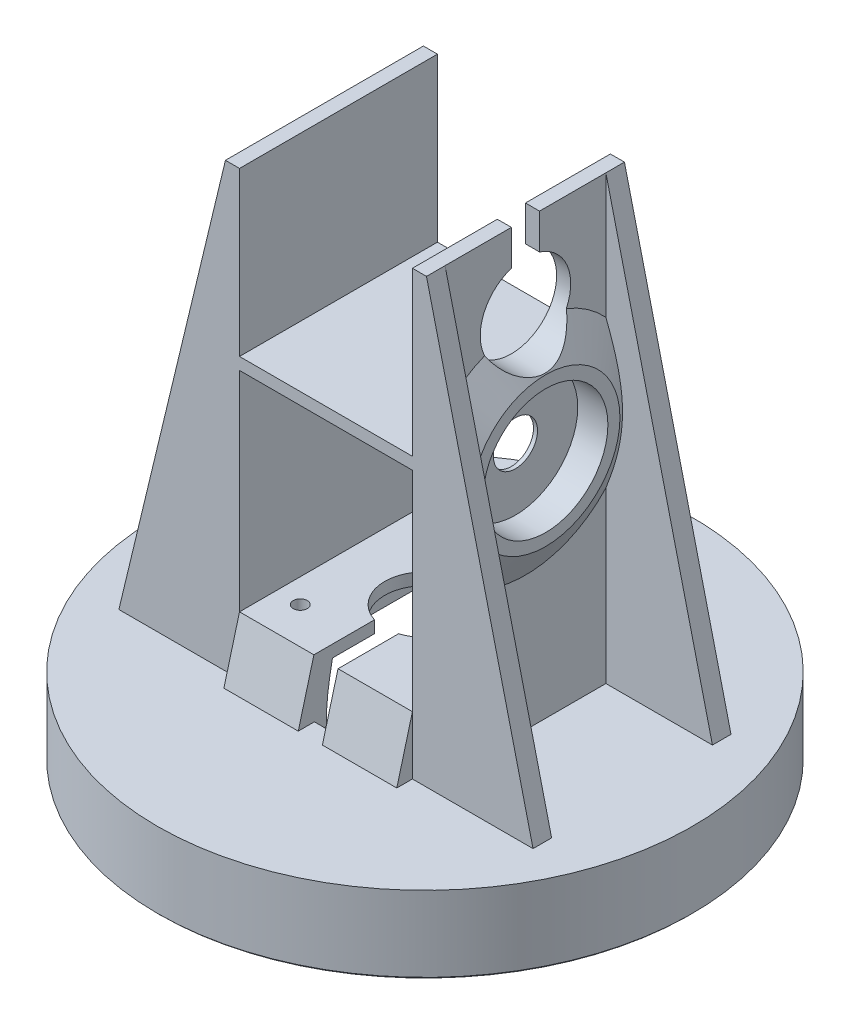
from build123d import *

# Parameters (mm, degrees)
SKETCH1_R            = 66.525
SKETCH1_R_2          = 63.525
BOSS_EXTRUDE1_DEPTH  = 16.75
SKETCH2_R            = 66.525
BOSS_EXTRUDE2_DEPTH  = 2.5
CHAMFER1_SIZE        = 0.5
SKETCH3_R            = 3
BOSS_EXTRUDE3_DEPTH  = 4
CHAMFER2_SIZE        = 0.5
CUT_EXTRUDE1_REACH   = 98.03
SKETCH4_W            = 43
SKETCH4_H            = 43
SKETCH5_W            = 43
SKETCH5_H            = 3
BOSS_EXTRUDE4_DEPTH  = 14.5
SKETCH6_W            = 43
SKETCH6_H            = 49
BOSS_EXTRUDE5_DEPTH  = 3
CUT_EXTRUDE2_REACH   = 101.951
SKETCH7_R            = 1.75
CHAMFER3_SIZE        = 4
CHAMFER3_SIZE_2      = 14.92820323
CHAMFER5_SIZE        = 1.5
CHAMFER5_SIZE2       = 8.506922729
FILLET1_R            = 50
BOSS_EXTRUDE6_DEPTH  = 4.614737
SKETCH10_W           = 3.5
SKETCH10_H           = 40
BOSS_EXTRUDE7_DEPTH  = 110
CUT_EXTRUDE3_REACH   = 171.94
SKETCH11_R           = 5.5
SKETCH12_R           = 15.5
CUT_EXTRUDE4_DEPTH   = 2.5
BOSS_EXTRUDE8_START  = 5
SKETCH13_R           = 18.5
SKETCH13_R_2         = 15.5
BOSS_EXTRUDE8_DEPTH  = 5
MIRROR4_COPY_1_DEPTH = 4.614737
CHAMFER7_SIZE        = 8.660254038
CHAMFER7_SIZE_2      = 5
SKETCH14_W           = 43
SKETCH14_H           = 3
BOSS_EXTRUDE9_DEPTH  = 49.229473419
CUT_EXTRUDE5_REACH   = 171.94


with BuildPart() as part:
    # Sketch1 → Boss-Extrude1 (new body)
    with BuildSketch(Plane(origin=(0, 0, 0), x_dir=(1, 0, 0), z_dir=(0, 1, 0))):
        with Locations(Location((0, 0, 0), (0, 0, 270))):
            Circle(SKETCH1_R)
        with Locations(Location((0, 0, 0), (0, 0, 270))):
            Circle(SKETCH1_R_2, mode=Mode.SUBTRACT)
    extrude(amount=BOSS_EXTRUDE1_DEPTH)

    # Sketch2 → Boss-Extrude2 (add)
    with BuildSketch(Plane(origin=(0, 16.75, 0), x_dir=(1, 0, 0), z_dir=(0, 1, 0))):
        with Locations(Location((0, 0, 0), (0, 0, 270))):
            Circle(SKETCH2_R)
    extrude(amount=BOSS_EXTRUDE2_DEPTH)

    # Chamfer1
    chamfer1_edges = [part.edges().sort_by_distance(p)[0] for p in [
        (0, 0, -66.525),
        (0, 0, -63.525),
    ]]
    chamfer(chamfer1_edges, length=CHAMFER1_SIZE)

    # Sketch3 → Boss-Extrude3 (add)
    with BuildSketch(Plane.XZ.offset(-16.75)):
        with Locations(Location((0, 37.5, 0), (0, 0, 90))):
            Circle(SKETCH3_R)
        with Locations(Location((37.5, 0, 0), (0, 0, 90))):
            Circle(SKETCH3_R)
        with Locations(Location((0, -37.5, 0), (0, 0, 90))):
            Circle(SKETCH3_R)
        with Locations(Location((-37.5, 0, 0), (0, 0, 90))):
            Circle(SKETCH3_R)
    extrude(amount=BOSS_EXTRUDE3_DEPTH)

    # Chamfer2
    chamfer2_edges = [part.edges().sort_by_distance(p)[0] for p in [
        (0, 16.75, 34.5),
        (37.5, 16.75, -3),
        (0, 16.75, -40.5),
        (-37.5, 16.75, -3),
    ]]
    chamfer(chamfer2_edges, length=CHAMFER2_SIZE)

    # Sketch4 → Cut-Extrude1 (cut, up to next)
    with BuildSketch(Plane(origin=(0, 19.25, 0), x_dir=(1, 0, 0), z_dir=(0, 1, 0)), mode=Mode.PRIVATE) as cut_extrude1_sk1:
        Rectangle(SKETCH4_W, SKETCH4_H)
    cut_extrude1_tool1 = extrude(cut_extrude1_sk1.sketch, amount=-CUT_EXTRUDE1_REACH, mode=Mode.PRIVATE) & part.part
    add(cut_extrude1_tool1.solids().sort_by_distance((0, 19.25, 0))[0], mode=Mode.SUBTRACT)

    # Sketch5 → Boss-Extrude4 (add)
    with BuildSketch(Plane(origin=(0, 19.25, 0), x_dir=(1, 0, 0), z_dir=(0, 1, 0))):
        with Locations((0, 23)):
            Rectangle(SKETCH5_W, SKETCH5_H)
        with Locations((0, -23)):
            Rectangle(SKETCH5_W, SKETCH5_H)
    extrude(amount=BOSS_EXTRUDE4_DEPTH)

    # Sketch6 → Boss-Extrude5 (add)
    with BuildSketch(Plane(origin=(0, 33.75, 0), x_dir=(1, 0, 0), z_dir=(0, 1, 0))):
        Rectangle(SKETCH6_W, SKETCH6_H)
    extrude(amount=-BOSS_EXTRUDE5_DEPTH)

    # Sketch7 → Cut-Extrude2 (cut, up to next)
    with BuildSketch(Plane(origin=(0, 33.75, 0), x_dir=(1, 0, 0), z_dir=(0, 1, 0)), mode=Mode.PRIVATE) as cut_extrude2_sk1:
        with Locations(Location((15.5, 15.5, 0), (0, 0, 270))):
            Circle(SKETCH7_R)
    cut_extrude2_tool1 = extrude(cut_extrude2_sk1.sketch, amount=-CUT_EXTRUDE2_REACH, mode=Mode.PRIVATE) & part.part
    # Sketch7 → Cut-Extrude2 (cut, up to next)
    with BuildSketch(Plane(origin=(0, 33.75, 0), x_dir=(1, 0, 0), z_dir=(0, 1, 0)), mode=Mode.PRIVATE) as cut_extrude2_sk2:
        with Locations(Location((-15.5, 15.5, 0), (0, 0, 270))):
            Circle(SKETCH7_R)
    cut_extrude2_tool2 = extrude(cut_extrude2_sk2.sketch, amount=-CUT_EXTRUDE2_REACH, mode=Mode.PRIVATE) & part.part
    # Sketch7 → Cut-Extrude2 (cut, up to next)
    with BuildSketch(Plane(origin=(0, 33.75, 0), x_dir=(1, 0, 0), z_dir=(0, 1, 0)), mode=Mode.PRIVATE) as cut_extrude2_sk3:
        with Locations(Location((-15.5, -15.5, 0), (0, 0, 270))):
            Circle(SKETCH7_R)
    cut_extrude2_tool3 = extrude(cut_extrude2_sk3.sketch, amount=-CUT_EXTRUDE2_REACH, mode=Mode.PRIVATE) & part.part
    # Sketch7 → Cut-Extrude2 (cut, up to next)
    with BuildSketch(Plane(origin=(0, 33.75, 0), x_dir=(1, 0, 0), z_dir=(0, 1, 0)), mode=Mode.PRIVATE) as cut_extrude2_sk4:
        with Locations(Location((15.5, -15.5, 0), (0, 0, 270))):
            Circle(SKETCH7_R)
    cut_extrude2_tool4 = extrude(cut_extrude2_sk4.sketch, amount=-CUT_EXTRUDE2_REACH, mode=Mode.PRIVATE) & part.part
    # Sketch7 → Cut-Extrude2 (cut, up to next)
    with BuildSketch(Plane(origin=(0, 33.75, 0), x_dir=(1, 0, 0), z_dir=(0, 1, 0)), mode=Mode.PRIVATE) as cut_extrude2_sk5:
        with BuildLine():
            Line((-3, -24.5), (-3, -9.539392014))
            ThreePointArc((-3, -9.539392014), (0, 10), (3, -9.539392014))
            Line((3, -9.539392014), (3, -24.5))
            Line((3, -24.5), (-3, -24.5))
        make_face()
    cut_extrude2_tool5 = extrude(cut_extrude2_sk5.sketch, amount=-CUT_EXTRUDE2_REACH, mode=Mode.PRIVATE) & part.part
    add(cut_extrude2_tool1.solids().sort_by_distance((15.5, 33.75, -15.5))[0], mode=Mode.SUBTRACT)
    add(cut_extrude2_tool2.solids().sort_by_distance((-15.5, 33.75, -15.5))[0], mode=Mode.SUBTRACT)
    add(cut_extrude2_tool3.solids().sort_by_distance((-15.5, 33.75, 15.5))[0], mode=Mode.SUBTRACT)
    add(cut_extrude2_tool4.solids().sort_by_distance((15.5, 33.75, 15.5))[0], mode=Mode.SUBTRACT)
    add(cut_extrude2_tool5.solids().sort_by_distance((0, 33.75, 3.754926))[0], mode=Mode.SUBTRACT)

    # Chamfer3
    # the kernel refuses this chamfer: 14.92820323, 4 mm, written as the material it adds along each edge
    with BuildSketch(Plane(origin=(-35.764387332, 19.25, 24.5), x_dir=(0, -0.13751244702129095, 0.9905000388259542), z_dir=(1, 0, 0))) as chamfer3_piece_1_section:
        Polygon((CHAMFER3_SIZE * 0.990500038826, -CHAMFER3_SIZE * 0.137512447021), (-CHAMFER3_SIZE_2 * 0.137512447024, -CHAMFER3_SIZE_2 * 0.990500038844), (0, 0), align=None)
    chamfer3_piece_1 = extrude(amount=96.028774665, mode=Mode.PRIVATE)
    chamfer3_piece_1 = split(chamfer3_piece_1, bisect_by=Plane(origin=(-3, 24.218107634, 25.834399786), z_dir=(-1, 0, 0)), keep=Keep.TOP, mode=Mode.PRIVATE)
    chamfer3_piece_1 = split(chamfer3_piece_1, bisect_by=Plane(origin=(-21.5, 24.218107634, 25.834399786), z_dir=(1, 0, 0)), keep=Keep.TOP, mode=Mode.PRIVATE)
    chamfer3_piece_1 = split(chamfer3_piece_1, bisect_by=Plane(origin=(-12.25, 33.75, 25.834399786), z_dir=(0, -1, 0)), keep=Keep.TOP, mode=Mode.PRIVATE)
    add(chamfer3_piece_1)
    with BuildSketch(Plane(origin=(3, 19.25, 24.5), x_dir=(0, -0.13751244702129095, 0.9905000388259542), z_dir=(1, 0, 0))) as chamfer3_piece_2_section:
        Polygon((CHAMFER3_SIZE * 0.990500038826, -CHAMFER3_SIZE * 0.137512447021), (-CHAMFER3_SIZE_2 * 0.137512447024, -CHAMFER3_SIZE_2 * 0.990500038844), (0, 0), align=None)
    chamfer3_piece_2 = extrude(amount=18.5, mode=Mode.PRIVATE)
    chamfer3_piece_2 = split(chamfer3_piece_2, bisect_by=Plane(origin=(12.25, 33.75, 25.834399786), z_dir=(0, -1, 0)), keep=Keep.TOP, mode=Mode.PRIVATE)
    add(chamfer3_piece_2)
    with BuildSketch(Plane(origin=(-21.5, 19.25, 24.5), x_dir=(0, -0.13751244702129095, 0.9905000388259542), z_dir=(1, 0, 0))) as chamfer3_piece_3_section:
        Polygon((CHAMFER3_SIZE * 0.990500038826, -CHAMFER3_SIZE * 0.137512447021), (-CHAMFER3_SIZE_2 * 0.137512447024, -CHAMFER3_SIZE_2 * 0.990500038844), (0, 0), align=None)
    chamfer3_piece_3 = extrude(amount=18.5, mode=Mode.PRIVATE)
    chamfer3_piece_3 = split(chamfer3_piece_3, bisect_by=Plane(origin=(-12.25, 33.75, 25.834399786), z_dir=(0, -1, 0)), keep=Keep.TOP, mode=Mode.PRIVATE)
    add(chamfer3_piece_3)
    with BuildSketch(Plane(origin=(-60.264387332, 19.25, 24.5), x_dir=(0, -0.13751244702129095, 0.9905000388259542), z_dir=(1, 0, 0))) as chamfer3_piece_4_section:
        Polygon((CHAMFER3_SIZE * 0.990500038826, -CHAMFER3_SIZE * 0.137512447021), (-CHAMFER3_SIZE_2 * 0.137512447024, -CHAMFER3_SIZE_2 * 0.990500038844), (0, 0), align=None)
    chamfer3_piece_4 = extrude(amount=96.028774665, mode=Mode.PRIVATE)
    chamfer3_piece_4 = split(chamfer3_piece_4, bisect_by=Plane(origin=(3, 24.218107634, 25.834399786), z_dir=(1, 0, 0)), keep=Keep.TOP, mode=Mode.PRIVATE)
    chamfer3_piece_4 = split(chamfer3_piece_4, bisect_by=Plane(origin=(21.5, 24.218107634, 25.834399786), z_dir=(-1, 0, 0)), keep=Keep.TOP, mode=Mode.PRIVATE)
    chamfer3_piece_4 = split(chamfer3_piece_4, bisect_by=Plane(origin=(12.25, 33.75, 25.834399786), z_dir=(0, -1, 0)), keep=Keep.TOP, mode=Mode.PRIVATE)
    add(chamfer3_piece_4)
    with BuildSketch(Plane(origin=(21.5, 19.25, -24.5), x_dir=(0, -0.13751244702129095, -0.9905000388259542), z_dir=(-1, 0, 0))) as chamfer3_piece_5_section:
        Polygon((CHAMFER3_SIZE * 0.990500038826, -CHAMFER3_SIZE * 0.137512447021), (-CHAMFER3_SIZE_2 * 0.137512447024, -CHAMFER3_SIZE_2 * 0.990500038844), (0, 0), align=None)
    chamfer3_piece_5 = extrude(amount=43, mode=Mode.PRIVATE)
    chamfer3_piece_5 = split(chamfer3_piece_5, bisect_by=Plane(origin=(0, 33.75, -25.834399786), z_dir=(0, -1, 0)), keep=Keep.TOP, mode=Mode.PRIVATE)
    add(chamfer3_piece_5)

    # Chamfer5
    chamfer5_edges = [part.edges().sort_by_distance(p)[0] for p in [
        (0, 30.75, -21.5),
        (12.25, 30.75, 21.5),
        (-12.25, 30.75, 21.5),
    ]]
    chamfer5_side = [part.faces().sort_by_distance(p)[0] for p in [
        (0, 30.75, -20.891888168),
    ]]
    chamfer(chamfer5_edges, length=CHAMFER5_SIZE, length2=CHAMFER5_SIZE2, reference=chamfer5_side[0])

    # Fillet1
    # the kernel refuses this fillet: 50 mm, written as the material it adds along each edge
    with BuildSketch(Plane(origin=(-21.5, 22.243077271, -21.5), x_dir=(0, 0.9848077530122084, 0.17364817766692914), z_dir=(1, 0, 0))) as fillet1_piece_1:
        with BuildLine():
            CenterArc((FILLET1_R * 0.0874886635259, FILLET1_R), FILLET1_R, 260, 10)
            Line((-FILLET1_R * 0.086159514141, FILLET1_R * 0.0151922469878), (0, 0))
            Line((0, 0), (FILLET1_R * 0.0874886635259, 0))
        make_face()
    extrude(amount=43)
    with BuildSketch(Plane(origin=(21.5, 22.243077271, 21.5), x_dir=(0, 0.9848077530122081, -0.17364817766692925), z_dir=(-1, 0, 0)), Plane(origin=(-3, 22.243077271, 21.5), x_dir=(0, 0.9848077530122081, -0.17364817766692925), z_dir=(-1, 0, 0))) as fillet1_piece_2:
        with BuildLine():
            CenterArc((FILLET1_R * 0.0874886635259, FILLET1_R), FILLET1_R, 260, 10)
            Line((-FILLET1_R * 0.086159514141, FILLET1_R * 0.0151922469878), (0, 0))
            Line((0, 0), (FILLET1_R * 0.0874886635259, 0))
        make_face()
    extrude(amount=18.5)
    with BuildSketch(Plane(origin=(21.5, 22.243077271, 21.5), x_dir=(0, 0.9848077530122081, -0.17364817766692925), z_dir=(-1, 0, 0))) as fillet1_piece_3_section:
        with BuildLine():
            CenterArc((FILLET1_R * 0.0874886635259, FILLET1_R), FILLET1_R, 260, 10)
            Line((-FILLET1_R * 0.086159514141, FILLET1_R * 0.0151922469878), (0, 0))
            Line((0, 0), (FILLET1_R * 0.0874886635259, 0))
        make_face()
    fillet1_piece_3 = extrude(amount=29.436082941, mode=Mode.PRIVATE)
    fillet1_piece_3 = split(fillet1_piece_3, bisect_by=Plane(origin=(-3, 22.267794389, 21.78251796), z_dir=(-1, 0, 0)), keep=Keep.TOP, mode=Mode.PRIVATE)
    add(fillet1_piece_3)
    with BuildSketch(Plane(origin=(7.936082941, 22.243077271, 21.5), x_dir=(0, 0.9848077530122081, -0.17364817766692925), z_dir=(-1, 0, 0))) as fillet1_piece_4_section:
        with BuildLine():
            CenterArc((FILLET1_R * 0.0874886635259, FILLET1_R), FILLET1_R, 260, 10)
            Line((-FILLET1_R * 0.086159514141, FILLET1_R * 0.0151922469878), (0, 0))
            Line((0, 0), (FILLET1_R * 0.0874886635259, 0))
        make_face()
    fillet1_piece_4 = extrude(amount=29.436082941, mode=Mode.PRIVATE)
    fillet1_piece_4 = split(fillet1_piece_4, bisect_by=Plane(origin=(3, 22.267794389, 21.78251796), z_dir=(1, 0, 0)), keep=Keep.TOP, mode=Mode.PRIVATE)
    add(fillet1_piece_4)

    # Sketch9 → Boss-Extrude6 (add)
    with BuildSketch(Plane.XY.offset(-20)):
        Polygon((21.5, 19.25), (21.5, 129.25), (25, 129.25), (51.5, 19.25), align=None)
    boss_extrude6 = extrude(amount=-BOSS_EXTRUDE6_DEPTH)

    # Mirror3: Boss-Extrude6 across plane
    add(boss_extrude6.mirror(Plane.XY))

    # Sketch10 → Boss-Extrude7 (add)
    with BuildSketch(Plane(origin=(0, 19.25, 0), x_dir=(1, 0, 0), z_dir=(0, 1, 0))):
        with Locations((23.25, 0)):
            Rectangle(SKETCH10_W, SKETCH10_H)
    boss_extrude7 = extrude(amount=BOSS_EXTRUDE7_DEPTH)

    # Sketch11 → Cut-Extrude3 (cut, up to next)
    with BuildSketch(Plane.ZY.offset(-21.5), mode=Mode.PRIVATE) as cut_extrude3_sk1:
        with Locations((0, 79.75)):
            Circle(SKETCH11_R)
    cut_extrude3_tool1 = extrude(cut_extrude3_sk1.sketch, amount=-CUT_EXTRUDE3_REACH, mode=Mode.PRIVATE) & part.part
    cut_extrude3 = cut_extrude3_tool1.solids().sort_by_distance((21.5, 79.75, 0))[0]
    add(cut_extrude3, mode=Mode.SUBTRACT)

    # Sketch12 → Cut-Extrude4 (cut)
    with BuildSketch(Plane(origin=(25, 0, 0), x_dir=(0, 0, -1), z_dir=(1, 0, 0))):
        with Locations((0, 79.75)):
            Circle(SKETCH12_R)
    cut_extrude4 = extrude(amount=-CUT_EXTRUDE4_DEPTH, mode=Mode.SUBTRACT)

    # Sketch13 → Boss-Extrude8 (add)
    with BuildSketch(Plane(origin=(25, 0, 0), x_dir=(0, 0, -1), z_dir=(1, 0, 0)).offset(BOSS_EXTRUDE8_START)):
        with Locations(Location((0, 79.75, 0), (0, 0, 180))):
            Circle(SKETCH13_R)
        with Locations((0, 79.75)):
            Circle(SKETCH13_R_2, mode=Mode.SUBTRACT)
    boss_extrude8 = extrude(amount=-BOSS_EXTRUDE8_DEPTH)

    # Mirror4: Boss-Extrude6, Boss-Extrude7, Cut-Extrude3, Cut-Extrude4, Boss-Extrude8 across plane
    add(boss_extrude6.mirror(Plane(origin=(0, 0, 0), x_dir=(0, 0, 1), z_dir=(1, 0, 0))))
    add(boss_extrude7.mirror(Plane(origin=(0, 0, 0), x_dir=(0, 0, 1), z_dir=(1, 0, 0))))
    add(cut_extrude3.mirror(Plane(origin=(0, 0, 0), x_dir=(0, 0, 1), z_dir=(1, 0, 0))), mode=Mode.SUBTRACT)
    add(cut_extrude4.mirror(Plane(origin=(0, 0, 0), x_dir=(0, 0, 1), z_dir=(1, 0, 0))), mode=Mode.SUBTRACT)
    add(boss_extrude8.mirror(Plane(origin=(0, 0, 0), x_dir=(0, 0, 1), z_dir=(1, 0, 0))))

    # Mirror4 copy 1 sketch → Mirror4 copy 1 (add)
    with BuildSketch(Plane(origin=(0, 0, 20), x_dir=(-1, 0, 0), z_dir=(0, 0, -1))):
        Polygon((21.5, 19.25), (21.5, 129.25), (25, 129.25), (51.5, 19.25), align=None)
    extrude(amount=-MIRROR4_COPY_1_DEPTH)

    # Chamfer7
    # the kernel refuses this chamfer: 8.660254038, 5 mm, written as the material it adds along each edge
    with BuildSketch(Plane(origin=(25, 79.75, 0), x_dir=(0, 0, 1), z_dir=(0, 1, 0))) as chamfer7_piece_1_section:
        Polygon((18.5 + CHAMFER7_SIZE, 0), (18.5, CHAMFER7_SIZE_2), (18.5, 0), align=None)
    chamfer7_piece_1 = revolve(axis=Axis((25, 79.75, 0), (1, 0, 0)), mode=Mode.PRIVATE)
    chamfer7_piece_1 = split(chamfer7_piece_1, bisect_by=Plane(origin=(25.718533096, 57.535930148, -20), z_dir=(0, 0, 1)), keep=Keep.TOP, mode=Mode.PRIVATE)
    chamfer7_piece_1 = split(chamfer7_piece_1, bisect_by=Plane(origin=(25.718533096, 57.535930148, 24.614737), z_dir=(0, 0, -1)), keep=Keep.TOP, mode=Mode.PRIVATE)
    add(chamfer7_piece_1)
    with BuildSketch(Plane(origin=(-25, 79.75, 0), x_dir=(0, 0, 1), z_dir=(0, 1, 0))) as chamfer7_piece_2_section:
        Polygon((18.5 + CHAMFER7_SIZE, 0), (18.5, -CHAMFER7_SIZE_2), (18.5, 0), align=None)
    chamfer7_piece_2 = revolve(axis=Axis((-25, 79.75, 0), (1, 0, 0)), mode=Mode.PRIVATE)
    chamfer7_piece_2 = split(chamfer7_piece_2, bisect_by=Plane(origin=(-25.718533096, 57.535930148, 20), z_dir=(0, 0, -1)), keep=Keep.TOP, mode=Mode.PRIVATE)
    chamfer7_piece_2 = split(chamfer7_piece_2, bisect_by=Plane(origin=(-25.718533096, 57.535930148, -24.614737), z_dir=(0, 0, 1)), keep=Keep.TOP, mode=Mode.PRIVATE)
    add(chamfer7_piece_2)

    # Sketch14 → Boss-Extrude9 (add)
    with BuildSketch(Plane.XY.offset(24.61473671)):
        with Locations((0, 87.25)):
            Rectangle(SKETCH14_W, SKETCH14_H)
    extrude(amount=-BOSS_EXTRUDE9_DEPTH)

    # Sketch15 → Cut-Extrude5 (cut, up to next)
    with BuildSketch(Plane.ZY.offset(-21.5), mode=Mode.PRIVATE) as cut_extrude5_sk1:
        with BuildLine():
            Line((-3.5, 129.25), (-3.5, 120.44170239))
            ThreePointArc((-3.5, 120.44170239), (0, 98.5), (3.5, 120.44170239))
            Line((3.5, 120.44170239), (3.5, 129.25))
            Line((3.5, 129.25), (-3.5, 129.25))
        make_face()
    cut_extrude5_tool1 = extrude(cut_extrude5_sk1.sketch, amount=-CUT_EXTRUDE5_REACH, mode=Mode.PRIVATE) & part.part
    add(cut_extrude5_tool1.solids().sort_by_distance((21.5, 111.7257, 0))[0], mode=Mode.SUBTRACT)


solid = part.part
